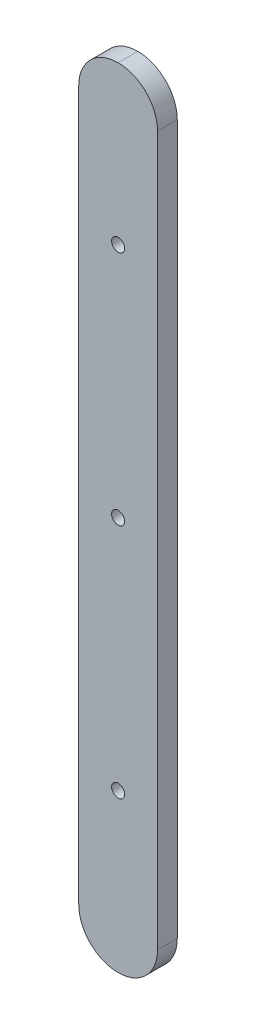
from build123d import *

# Parameters (mm, degrees)
SKETCH1_W           = 20
SKETCH1_H           = 200
SKETCH1_R           = 1.65
BOSS_EXTRUDE1_DEPTH = 5
FILLET1_R           = 10


with BuildPart() as part:
    # Sketch1 → Boss-Extrude1 (new body)
    with BuildSketch(Plane.XY):
        with Locations((10, 100)):
            Rectangle(SKETCH1_W, SKETCH1_H)
        with Locations((10, 160)):
            Circle(SKETCH1_R, mode=Mode.SUBTRACT)
        with Locations((10, 100)):
            Circle(SKETCH1_R, mode=Mode.SUBTRACT)
        with Locations((10, 40)):
            Circle(SKETCH1_R, mode=Mode.SUBTRACT)
    extrude(amount=BOSS_EXTRUDE1_DEPTH)

    # Fillet1
    fillet1_edges = [part.edges().sort_by_distance(p)[0] for p in [
        (0, 0, 2.5),
        (20, 0, 2.5),
        (20, 200, 2.5),
        (0, 200, 2.5),
    ]]
    fillet(fillet1_edges, radius=FILLET1_R - 0.0001)  # a hair under: the kernel refuses the full size


solid = part.part
